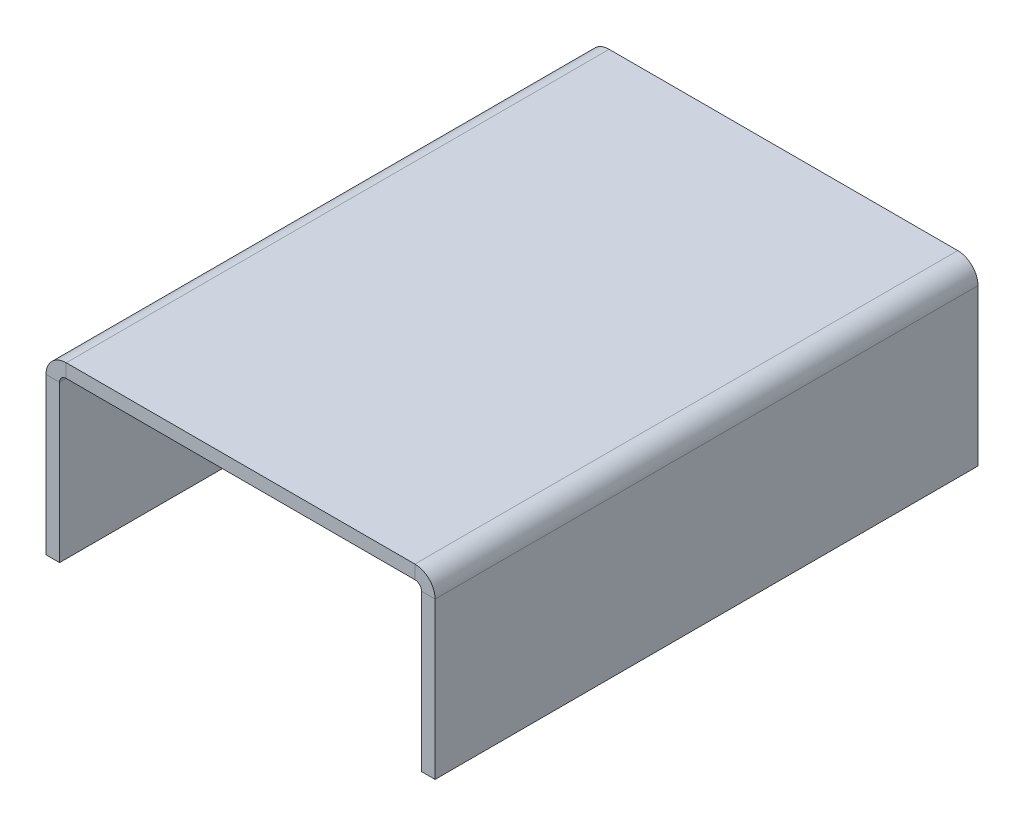
from build123d import *

# Parameters (mm, degrees)
BASE_FLANGE1_DEPTH = 30


# Sheet-metal steps are written as plain solids
with BuildPart() as part:
    # Sketch1 → Base-Flange1 (new, symmetric)
    with BuildSketch(Plane.XY):
        with BuildLine():
            Line((-20, -9), (-20, 8.2634))
            ThreePointArc((-20, 8.2634), (-19.784254855, 8.784254855), (-19.2634, 9))
            Line((-19.2634, 9), (19.2634, 9))
            ThreePointArc((19.2634, 9), (19.784254855, 8.784254855), (20, 8.2634))
            Line((20, 8.2634), (20, -9))
            Line((20, -9), (21.5, -9))
            Line((21.5, -9), (21.5, 8.2634))
            ThreePointArc((21.5, 8.2634), (20.844915027, 9.844915027), (19.2634, 10.5))
            Line((19.2634, 10.5), (-19.2634, 10.5))
            ThreePointArc((-19.2634, 10.5), (-20.844915027, 9.844915027), (-21.5, 8.2634))
            Line((-21.5, 8.2634), (-21.5, -9))
            Line((-21.5, -9), (-20, -9))
        make_face()
    extrude(amount=BASE_FLANGE1_DEPTH, both=True)


solid = part.part
